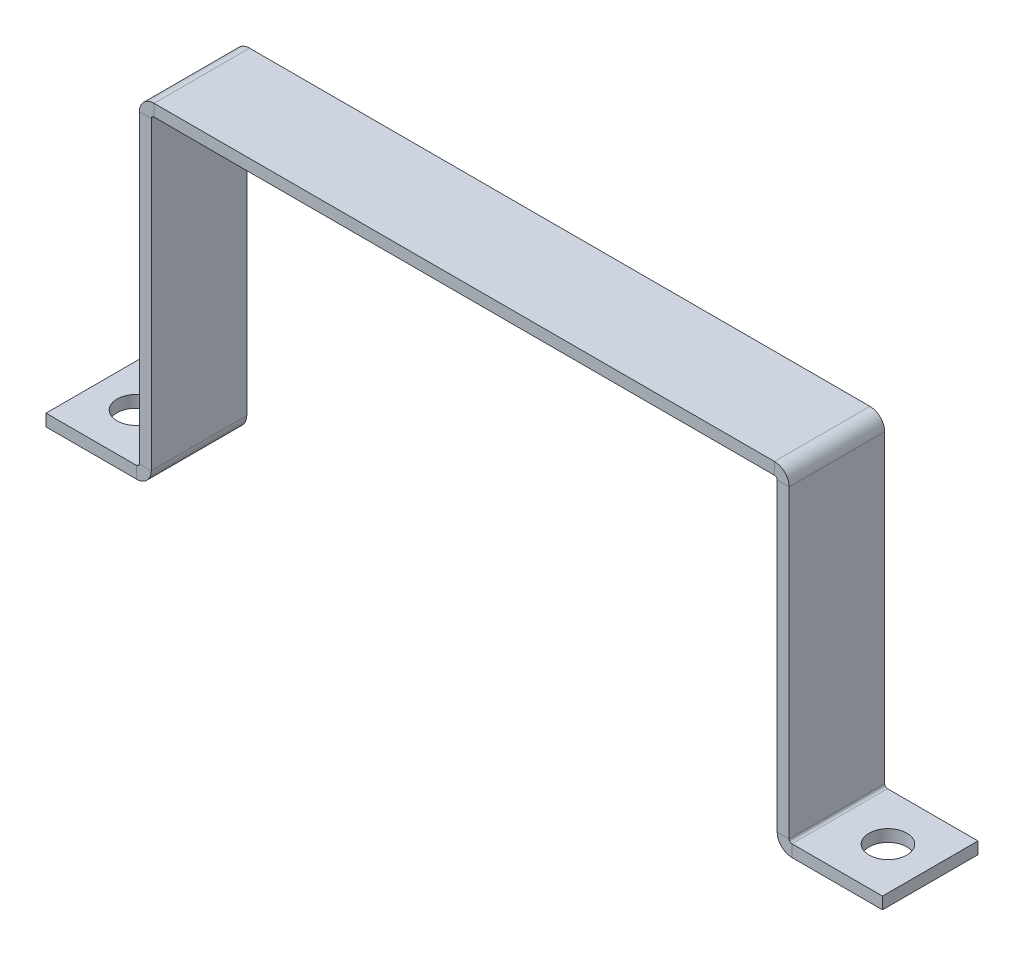
from build123d import *

# Parameters (mm, degrees)
CROQUIS1_W                    = 165
CROQUIS1_H                    = 3.175
BRIDA_BASE1_DEPTH             = 25.4
BRIDA_DE_ARISTA1_DEPTH        = 25.4
BRIDA_DE_ARISTA1_BEND_DEPTH   = 25.4
BRIDA_DE_ARISTA2_DEPTH        = 25.4
BRIDA_DE_ARISTA2_BEND_DEPTH   = 25.4
TALADRO_DE_MARGEN_PARA_3_81_D = 10.0838


# Sheet-metal steps are written as plain solids
with BuildPart() as part:
    # Croquis1 → Brida base1 (new body)
    with BuildSketch(Plane.XY):
        with Locations((6.420112782, -1.5875)):
            Rectangle(CROQUIS1_W, CROQUIS1_H)
    extrude(amount=BRIDA_BASE1_DEPTH)

    # Brida de arista1 section (across the edge) → Brida de arista1 (add)
    with BuildSketch(Plane(origin=(89.656712782, -3.175, 0), x_dir=(-1, 0, 0), z_dir=(0, 0, 1))):
        with BuildLine():
            Line((-3.175, 0.7366), (-3.175, 81.825))
            Line((-3.175, 81.825), (0, 81.825))
            Line((0, 81.825), (0, 0.7366))
            ThreePointArc((0, 0.7366), (0.215745145, 0.215745145), (0.7366, 0))
            Line((0.7366, 0), (0.7366, -3.175))
            ThreePointArc((0.7366, -3.175), (-2.029318885, -2.029318885), (-3.175, 0.7366))
        make_face()
    extrude(amount=BRIDA_DE_ARISTA1_DEPTH)

    # Brida de arista1 section 2 (across the edge) → Brida de arista1 bend (add)
    with BuildSketch(Plane(origin=(-76.816487218, -3.175, 25.4), x_dir=(1, 0, 0), z_dir=(0, 0, -1))):
        with BuildLine():
            Line((-3.175, 0.7366), (-3.175, 81.825))
            Line((-3.175, 81.825), (0, 81.825))
            Line((0, 81.825), (0, 0.7366))
            ThreePointArc((0, 0.7366), (0.215745145, 0.215745145), (0.7366, 0))
            Line((0.7366, 0), (0.7366, -3.175))
            ThreePointArc((0.7366, -3.175), (-2.029318885, -2.029318885), (-3.175, 0.7366))
        make_face()
    extrude(amount=BRIDA_DE_ARISTA1_BEND_DEPTH)

    # Brida de arista2 section (across the edge) → Brida de arista2 (add)
    with BuildSketch(Plane(origin=(92.831712782, -85.7366, 25.4), x_dir=(0, 1, 0), z_dir=(0, 0, -1))):
        with BuildLine():
            Line((-3.175, 0.7366), (-3.175, 24.825))
            Line((-3.175, 24.825), (0, 24.825))
            Line((0, 24.825), (0, 0.7366))
            ThreePointArc((0, 0.7366), (0.215745145, 0.215745145), (0.7366, 0))
            Line((0.7366, 0), (0.7366, -3.175))
            ThreePointArc((0.7366, -3.175), (-2.029318885, -2.029318885), (-3.175, 0.7366))
        make_face()
    extrude(amount=BRIDA_DE_ARISTA2_DEPTH)

    # Brida de arista2 section 2 (across the edge) → Brida de arista2 bend (add)
    with BuildSketch(Plane(origin=(-79.991487218, -85.7366, 0), x_dir=(0, 1, 0), z_dir=(0, 0, 1))):
        with BuildLine():
            Line((-3.175, 0.7366), (-3.175, 24.825))
            Line((-3.175, 24.825), (0, 24.825))
            Line((0, 24.825), (0, 0.7366))
            ThreePointArc((0, 0.7366), (0.215745145, 0.215745145), (0.7366, 0))
            Line((0.7366, 0), (0.7366, -3.175))
            ThreePointArc((0.7366, -3.175), (-2.029318885, -2.029318885), (-3.175, 0.7366))
        make_face()
    extrude(amount=BRIDA_DE_ARISTA2_BEND_DEPTH)

    # Taladro de margen para 3/81 (through all)
    with Locations(Plane(origin=(0, -88.9116, 0), x_dir=(-1, 0, 0), z_dir=(0, -1, 0))):
        with Locations((93.586487218, -12.7), (-106.413512782, -12.7)):
            Hole(TALADRO_DE_MARGEN_PARA_3_81_D / 2)


solid = part.part
